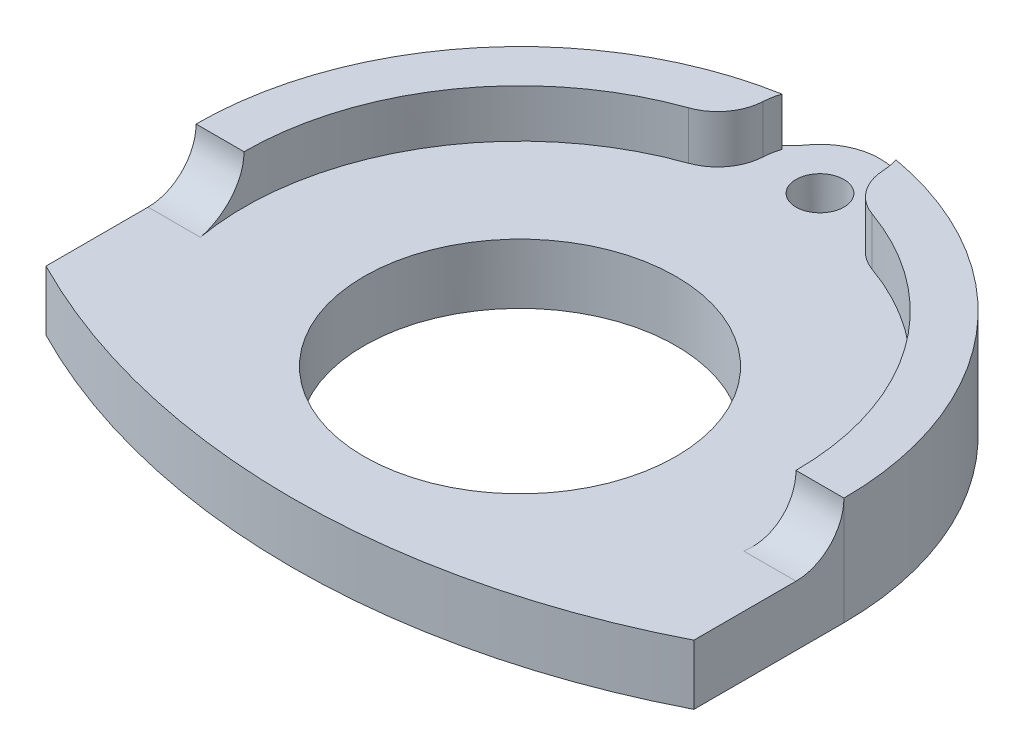
from build123d import *

# Parameters (mm, degrees)
SKETCH1_R                  = 6.5
SKETCH1_R_2                = 1
MAIN_EXTRUDE_DEPTH         = 2.5
BATTERY_START              = 2
BATTERY_RING_CRADDLE_DEPTH = 2
FILLETS_R                  = 2


with BuildPart() as part:
    # Sketch1 → Main extrude (new body)
    with BuildSketch(Plane.XZ.offset(-2.5)):
        with BuildLine():
            Line((-13.5, 26.437647872), (-13.5, 20.185))
            ThreePointArc((-13.5, 20.185), (-10.350618886, 11.518126938), (-2.371897974, 6.895))
            ThreePointArc((-2.371897974, 6.895), (0, 5.185), (2.371897974, 6.895))
            ThreePointArc((2.371897974, 6.895), (10.350618886, 11.518126938), (13.5, 20.185))
            Line((13.5, 20.185), (13.5, 26.437647872))
            ThreePointArc((13.5, 26.437647872), (0, 29.685), (-13.5, 26.437647872))
        make_face()
        with Locations(Location((0, 20.185, 0), (0, 0, 90))):
            Circle(SKETCH1_R, mode=Mode.SUBTRACT)
        with Locations(Location((0, 7.685, 0), (0, 0, 90))):
            Circle(SKETCH1_R_2, mode=Mode.SUBTRACT)
    extrude(amount=MAIN_EXTRUDE_DEPTH)

    # Sketch2 → Battery ring craddle (add)
    with BuildSketch(Plane(origin=(0, 2.5, 0), x_dir=(1, 0, 0), z_dir=(0, 1, 0)).offset(BATTERY_START)):
        with BuildLine():
            Line((-13.5, -20.185), (-11.5, -20.185))
            ThreePointArc((-11.5, -20.185), (-9.38817648, -13.543302748), (-3.828323063, -9.340925926))
            ThreePointArc((-3.828323063, -9.340925926), (-2.89145393, -8.651439161), (-2.496732433, -7.557222222))
            ThreePointArc((-2.496732433, -7.557222222), (-2.456730567, -7.221885627), (-2.371897974, -6.895))
            ThreePointArc((-2.371897974, -6.895), (-10.350618886, -11.518126938), (-13.5, -20.185))
        make_face()
        with BuildLine():
            Line((13.5, -20.185), (11.5, -20.185))
            ThreePointArc((11.5, -20.185), (9.38817648, -13.543302748), (3.828323063, -9.340925926))
            ThreePointArc((3.828323063, -9.340925926), (2.89145393, -8.651439161), (2.496732433, -7.557222222))
            ThreePointArc((2.496732433, -7.557222222), (2.456730567, -7.221885627), (2.371897974, -6.895))
            ThreePointArc((2.371897974, -6.895), (10.350618886, -11.518126938), (13.5, -20.185))
        make_face()
    extrude(amount=-BATTERY_RING_CRADDLE_DEPTH)

    # Fillets
    # the kernel refuses this fillet: 2 mm, written as the material it adds along each edge
    with BuildSketch(Plane(origin=(2.371897974, 2.5, 6.895), x_dir=(-0.4457237071000903, 0, -0.8951705853796543), z_dir=(0, -1, 0))) as fillets_piece_1:
        with BuildLine():
            CenterArc((0.980073907, 1.980300021), FILLETS_R, 220.3095964, 41.641946396)
            ThreePointArc((-0.545046071, 0.686465004), (-0.266950187, 0.347657285), (0, 0))
            ThreePointArc((0, 0), (0.350026395, 0.024624973), (0.700052791, 0))
        make_face()
    extrude(amount=2.5)
    with BuildSketch(Plane(origin=(-2.371897974, 2.5, 6.895), x_dir=(-0.9782217139639082, 0, 0.20756270939047247), z_dir=(0, -1, 0))) as fillets_piece_2:
        with BuildLine():
            CenterArc((0.941460954, 1.9989458), FILLETS_R, 226.497666749, 41.641946396)
            ThreePointArc((-0.435307275, 0.548253123), (-0.198368351, 0.289438878), (0, 0))
            ThreePointArc((0, 0), (0.438266306, 0.007115851), (0.876532612, 0))
        make_face()
    extrude(amount=2.5)
    with BuildSketch(Plane(origin=(-13.5, 2.5, 20.185), x_dir=(0, 0, 1), z_dir=(1, 0, 0))) as fillets_piece_3_section:
        with BuildLine():
            CenterArc((FILLETS_R, -FILLETS_R), FILLETS_R, 90, 90)
            Line((0, -FILLETS_R), (0, 0))
            Line((0, 0), (FILLETS_R, 0))
        make_face()
    fillets_piece_3 = extrude(amount=7, mode=Mode.PRIVATE)
    fillets_piece_3 = fillets_piece_3 - Plane(origin=(0, 2.67362595, 20.185), x_dir=(-1, 0, 0), z_dir=(0, 1, 0)) * Cylinder(11.5, 22, mode=Mode.PRIVATE)
    add(fillets_piece_3)
    with BuildSketch(Plane(origin=(13.5, 2.5, 20.185), x_dir=(0, 0, 1), z_dir=(-1, 0, 0))) as fillets_piece_4_section:
        with BuildLine():
            CenterArc((FILLETS_R, FILLETS_R), FILLETS_R, 180, 90)
            Line((0, FILLETS_R), (0, 0))
            Line((0, 0), (FILLETS_R, 0))
        make_face()
    fillets_piece_4 = extrude(amount=7, mode=Mode.PRIVATE)
    fillets_piece_4 = fillets_piece_4 - Plane(origin=(0, 2.673614475, 20.185), x_dir=(1, 0, 0), z_dir=(0, 1, 0)) * Cylinder(11.5, 22, mode=Mode.PRIVATE)
    add(fillets_piece_4)


solid = part.part
